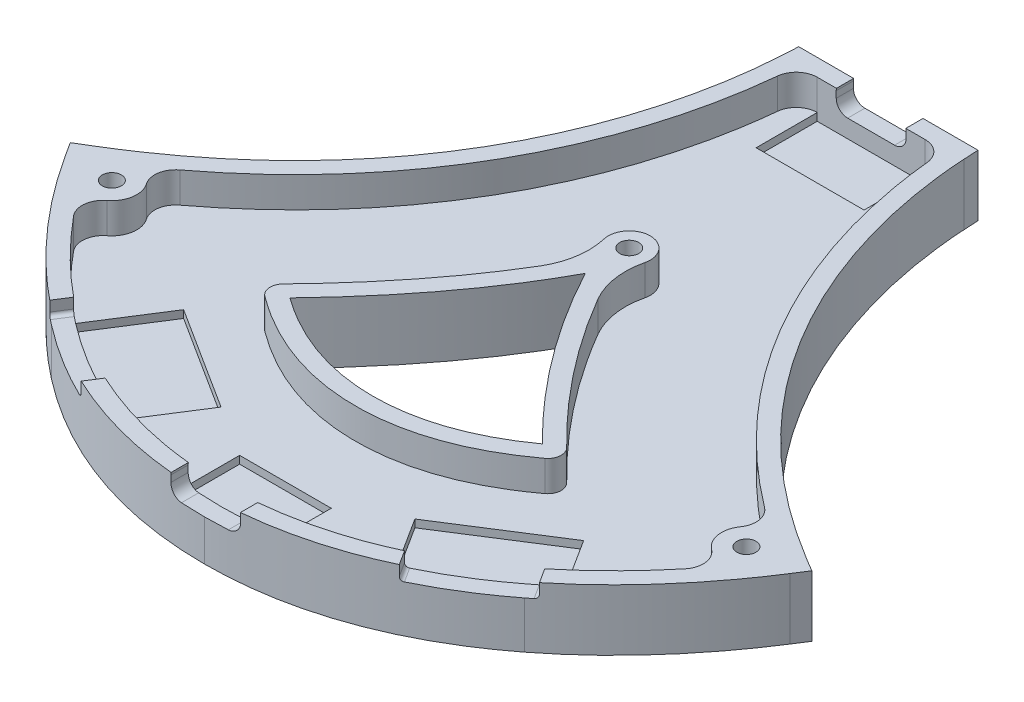
from build123d import *

# Parameters (mm, degrees)
BOSS_EXTRUDE4_DEPTH            = 3
SKETCH16_R                     = 3.25
CUT_EXTRUDE1_DEPTH             = 1.5
BOSS_EXTRUDE5_DEPTH            = 5
CBORE_FOR_M2_SHCS1_D           = 2.5
CBORE_FOR_M2_SHCS1_CBORE_D     = 4.4
CBORE_FOR_M2_SHCS1_CBORE_DEPTH = 2.75
CBORE_FOR_M2_SHCS2_D           = 2.5
CBORE_FOR_M2_SHCS2_CBORE_D     = 4.4
CBORE_FOR_M2_SHCS2_CBORE_DEPTH = 2.75
BOSS_EXTRUDE9_DEPTH            = 1
CUT_EXTRUDE11_DEPTH            = 5
CUT_EXTRUDE12_DEPTH            = 3
CUT_EXTRUDE13_DEPTH            = 4
CUT_EXTRUDE14_DEPTH            = 3


with BuildPart() as part:
    # Sketch10 → Boss-Extrude4 (new body)
    with BuildSketch(Plane(origin=(0, 0, 0), x_dir=(1, 0, 0), z_dir=(0, 1, 0))):
        with BuildLine():
            Line((48.547041226, -18.901094131), (46.77347558, -17.832646274))
            add(Edge.make_bspline(
                [(46.77347558, -17.832646274), (17.003528636, 0.102276889), (12.429063845, 27.023248475), (11.844136588, 37.765129514)],
                knots=[0, 0, 0, 0, 1, 1, 1, 1], degree=3))
            Line((11.844136588, 37.765129514), (11.740234172, 39.673072115))
            Line((11.740234172, 39.673072115), (-11.731466174, 39.673072115))
            Line((-11.731466174, 39.673072115), (-11.83536859, 37.765129514))
            add(Edge.make_bspline(
                [(-11.83536859, 37.765129514), (-12.420033135, 27.025612879), (-16.994235215, 0.109895523), (-46.766415207, -17.828442889)],
                knots=[4, 4, 4, 4, 5, 5, 5, 5], degree=3))
            Line((-46.766415207, -17.828442889), (-48.539586785, -18.896890746))
            Line((-48.539586785, -18.896890746), (-47.425952543, -20.641820833))
            add(Edge.make_bspline(
                [(-47.425952543, -20.641820833), (-44.221791175, -25.663026608), (-38.763958811, -32.914390694), (-30.959324209, -38.945196939)],
                knots=[7, 7, 7, 7, 8, 8, 8, 8], degree=3))
            add(Edge.make_bspline(
                [(-30.959324209, -38.945196939), (-21.548865284, -46.216789814), (-11.131170292, -49.903946359), (0.004383999, -49.903946359)],
                knots=[8, 8, 8, 8, 9, 9, 9, 9], degree=3))
            add(Edge.make_bspline(
                [(0.004383999, -49.903946359), (11.137573886, -49.903946359), (21.55395532, -46.217840661), (30.963888822, -38.948086766)],
                knots=[9, 9, 9, 9, 10, 10, 10, 10], degree=3))
            add(Edge.make_bspline(
                [(30.963888822, -38.948086766), (38.769705626, -32.917805944), (44.228326125, -25.666967281), (47.433012916, -20.646286929)],
                knots=[10, 10, 10, 10, 11, 11, 11, 11], degree=3))
            Line((47.433012916, -20.646286929), (48.547041226, -18.901094131))
        make_face()
        with BuildLine():
            add(Edge.make_bspline(
                [(16.526280274, -22.153643682), (11.287253789, -25.927609973), (5.739508399, -27.844583284), (0.004383999, -27.844583284), (-5.746437416, -27.844583284), (-11.308763297, -25.916920897), (-16.560367097, -22.122561622)],
                knots=[0, 0, 0, 0, 1, 1, 1, 2, 2, 2, 2], degree=3))
            add(Edge.make_bspline(
                [(-16.560367097, -22.122561622), (-9.578627154, -14.894792316), (-4.026727637, -7.475539132), (0, 0)],
                knots=[2, 2, 2, 2, 3, 3, 3, 3], degree=3))
            add(Edge.make_bspline(
                [(0, 0), (3.742194614, -7.061308703), (9.0389848, -14.76074375), (16.526280274, -22.153643682)],
                knots=[3, 3, 3, 3, 4, 4, 4, 4], degree=3))
        make_face(mode=Mode.SUBTRACT)
    extrude(amount=BOSS_EXTRUDE4_DEPTH)

    # Sketch16 → Cut-Extrude1 (cut)
    with BuildSketch(Plane.XZ):
        with Locations(Location((-41.547041226, 20.401094131, 0), (0, 0, 270))):
            Circle(SKETCH16_R)
        with Locations(Location((41.547041226, 20.401094131, 0), (0, 0, 270))):
            Circle(SKETCH16_R)
        with Locations(Location((0, -32.673072115, 0), (0, 0, 270))):
            Circle(SKETCH16_R)
        with Locations(Location((0, 42.903946359, 0), (0, 0, 270))):
            Circle(SKETCH16_R)
    extrude(amount=-CUT_EXTRUDE1_DEPTH, mode=Mode.SUBTRACT)

    # Sketch17 → Boss-Extrude5 (add)
    # profile 1 of 2: a face of its own
    with BuildSketch(Plane(origin=(0, 3, 0), x_dir=(1, 0, 0), z_dir=(0, 1, 0))):
        with BuildLine():
            Line((47.433012916, -20.646286929), (48.547041226, -18.901094131))
            Line((48.547041226, -18.901094131), (46.77347558, -17.832646274))
            add(Edge.make_bspline(
                [(46.77347558, -17.832646274), (17.003528636, 0.102276889), (12.429063845, 27.023248475), (11.844136588, 37.765129514)],
                knots=[0, 0, 0, 0, 1, 1, 1, 1], degree=3))
            Line((11.844136588, 37.765129514), (11.740234172, 39.673072115))
            Line((11.740234172, 39.673072115), (-11.731466174, 39.673072115))
            Line((-11.731466174, 39.673072115), (-11.83536859, 37.765129514))
            add(Edge.make_bspline(
                [(-11.83536859, 37.765129514), (-12.420033135, 27.025612879), (-16.994235215, 0.109895523), (-46.766415207, -17.828442889)],
                knots=[4, 4, 4, 4, 5, 5, 5, 5], degree=3))
            Line((-46.766415207, -17.828442889), (-48.539586785, -18.896890746))
            Line((-48.539586785, -18.896890746), (-47.425952543, -20.641820833))
            add(Edge.make_bspline(
                [(-47.425952543, -20.641820833), (-44.221791175, -25.663026608), (-38.763958811, -32.914390694), (-30.959324209, -38.945196939)],
                knots=[7, 7, 7, 7, 8, 8, 8, 8], degree=3))
            add(Edge.make_bspline(
                [(-30.959324209, -38.945196939), (-21.548865284, -46.216789814), (-11.131170292, -49.903946359), (0.004383999, -49.903946359)],
                knots=[8, 8, 8, 8, 9, 9, 9, 9], degree=3))
            add(Edge.make_bspline(
                [(0.004383999, -49.903946359), (11.137573886, -49.903946359), (21.55395532, -46.217840661), (30.963888822, -38.948086766)],
                knots=[9, 9, 9, 9, 10, 10, 10, 10], degree=3))
            add(Edge.make_bspline(
                [(30.963888822, -38.948086766), (38.769705626, -32.917805944), (44.228326125, -25.666967281), (47.433012916, -20.646286929)],
                knots=[10, 10, 10, 10, 11, 11, 11, 11], degree=3))
        make_face()
        with BuildLine():
            Line((7.068263687, 37.423072115), (-7.059496612, 37.423072115))
            ThreePointArc((-7.059496612, 37.423072115), (-8.905984327, 36.71095904), (-9.796175282, 34.943423474))
            add(Edge.make_bspline(
                [(-9.796175282, 34.943423474), (-10.039732368, 32.47793931), (-10.421381512, 30.041875059), (-11.434121187, 25.222888962), (-12.066446549, 22.840230191), (-13.205408829, 19.306821742), (-13.615505418, 18.14048746), (-14.492032045, 15.84181519), (-14.959028518, 14.707696156), (-16.445333502, 11.350522238), (-17.549431756, 9.172372061), (-19.984998159, 4.936486963), (-21.31627046, 2.87864832), (-23.486631791, -0.116248879), (-24.240945703, -1.101428661), (-25.792844121, -3.02222348), (-26.591464782, -3.959580749), (-30.694623315, -8.534522128), (-34.328172554, -11.837744424), (-38.280471055, -14.817033894)],
                knots=[0, 0, 0, 0, 0.125, 0.125, 0.25, 0.25, 0.3125, 0.3125, 0.375, 0.375, 0.5, 0.5, 0.625, 0.625, 0.6875, 0.6875, 0.75, 0.75, 1, 1, 1, 1], degree=3))
            ThreePointArc((-38.280471055, -14.817033894), (-39.341345642, -16.583061328), (-38.87779291, -18.59040451))
            ThreePointArc((-38.87779291, -18.59040451), (-38.328780037, -20.955513475), (-39.57199047, -23.041078565))
            ThreePointArc((-39.57199047, -23.041078565), (-40.638859687, -24.916061766), (-40.024485045, -26.983987965))
            add(Edge.make_bspline(
                [(-40.024485045, -26.983987965), (-38.469797239, -28.86056891), (-36.823428894, -30.659562666), (-33.341324403, -34.06968609), (-31.512203206, -35.67450945), (-29.583574251, -37.164800339)],
                knots=[0, 0, 0, 0, 0.5, 0.5, 1, 1, 1, 1], degree=3))
            add(Edge.make_bspline(
                [(-29.583574251, -37.164800339), (-27.462446118, -38.803825001), (-25.240902366, -40.291315562), (-20.565069837, -42.915068374), (-18.137786084, -44.035601692), (-13.092505846, -45.852667021), (-10.526062099, -46.530162707), (-5.319023979, -47.4304649), (-2.676532245, -47.653946359), (0.004383999, -47.653946359)],
                knots=[0, 0, 0, 0, 0.25, 0.25, 0.5, 0.5, 0.75, 0.75, 1, 1, 1, 1], degree=3))
            add(Edge.make_bspline(
                [(0.004383999, -47.653946359), (2.685429209, -47.653946359), (5.347189627, -47.430517033), (10.62983598, -46.510095696), (13.192640025, -45.823090359), (16.922419268, -44.47439355), (18.146840012, -43.971755386), (20.558934954, -42.862958017), (21.748760756, -42.255577496), (25.250267003, -40.290301886), (27.469181884, -38.804715085), (29.588341214, -37.167533824)],
                knots=[0, 0, 0, 0, 0.25, 0.25, 0.5, 0.5, 0.625, 0.625, 0.75, 0.75, 1, 1, 1, 1], degree=3))
            add(Edge.make_bspline(
                [(29.588341214, -37.167533824), (31.516845192, -35.677693306), (33.350363623, -34.069285997), (36.832552375, -30.65939756), (38.475605265, -28.864292177), (40.030337711, -26.988124476)],
                knots=[0, 0, 0, 0, 0.5, 0.5, 1, 1, 1, 1], degree=3))
            ThreePointArc((40.030337711, -26.988124476), (40.644965678, -24.920282954), (39.5783368, -23.045172574))
            ThreePointArc((39.5783368, -23.045172574), (38.335447125, -20.959802509), (38.884296078, -18.594996411))
            ThreePointArc((38.884296078, -18.594996411), (39.347726523, -16.587708365), (38.286886104, -14.821755172))
            add(Edge.make_bspline(
                [(38.286886104, -14.821755172), (34.332887388, -11.841239648), (30.685979543, -8.526627175), (26.557173498, -3.915732969), (25.757161766, -2.974552088), (24.213208924, -1.059967377), (23.468484471, -0.085673815), (21.315924071, 2.888121311), (19.989504384, 4.938414605), (17.554541532, 9.174923988), (16.44615102, 11.361235309), (14.950565713, 14.74488593), (14.479012929, 15.892963891), (13.60137214, 18.201035618), (13.194284372, 19.362992403), (12.066139526, 22.872106473), (11.437727037, 25.242389185), (10.429926535, 30.045114719), (10.048566345, 32.477065255), (9.804944934, 34.943397382)],
                knots=[0, 0, 0, 0, 0.25, 0.25, 0.3125, 0.3125, 0.375, 0.375, 0.5, 0.5, 0.625, 0.625, 0.6875, 0.6875, 0.75, 0.75, 0.875, 0.875, 1, 1, 1, 1], degree=3))
            ThreePointArc((9.804944934, 34.943397382), (8.914761116, 36.710950238), (7.068263687, 37.423072115))
        make_face(mode=Mode.SUBTRACT)
    # profile 2 of 2: a face of its own
    with BuildSketch(Plane(origin=(0, 3, 0), x_dir=(1, 0, 0), z_dir=(0, 1, 0))):
        with BuildLine():
            ThreePointArc((-18.579688368, -20.974510995), (-19.064277876, -22.343746169), (-18.348004118, -23.607306161))
            add(Edge.make_bspline(
                [(-18.348004118, -23.607306161), (-18.012692164, -23.850333745), (-17.677272802, -24.093155875), (-16.99950857, -24.565552777), (-16.657516563, -24.795802516), (-15.621935318, -25.468178516), (-14.918751273, -25.891951487), (-12.768237713, -27.084917916), (-11.279878536, -27.775628365), (-8.952153454, -28.629618242), (-8.156750344, -28.884541269), (-6.560416934, -29.320699228), (-5.757253558, -29.503034929), (-3.332726817, -29.942478869), (-1.696317866, -30.091959748), (0.789097247, -30.09584373), (1.623416737, -30.059869103), (3.268841467, -29.914767842), (4.084194809, -29.805797892), (6.508735237, -29.372389001), (8.096407676, -28.941475507), (10.436615111, -28.090708257), (11.205838328, -27.774096437), (12.707615729, -27.086345799), (13.442779643, -26.714186997), (14.884076987, -25.917653535), (15.590256675, -25.493362078), (16.629305369, -24.820554558), (16.97228153, -24.590217793), (17.65169929, -24.117790831), (17.987816018, -23.875116302), (18.323853111, -23.632298541)],
                knots=[0, 0, 0, 0, 0.03125, 0.03125, 0.0625, 0.0625, 0.125, 0.125, 0.25, 0.25, 0.3125, 0.3125, 0.375, 0.375, 0.5, 0.5, 0.5625, 0.5625, 0.625, 0.625, 0.75, 0.75, 0.8125, 0.8125, 0.875, 0.875, 0.9375, 0.9375, 0.96875, 0.96875, 1, 1, 1, 1], degree=3))
            ThreePointArc((18.323853111, -23.632298541), (19.043759767, -22.347888183), (18.528461955, -20.96859716))
            add(Edge.make_bspline(
                [(18.528461955, -20.96859716), (17.814540035, -20.263675959), (17.104490754, -19.555039431), (15.714770576, -18.108621986), (15.031825376, -17.373982367), (13.01917225, -15.135350803), (11.728485296, -13.59984981), (8.012778443, -8.862651272), (5.759492587, -5.55111656), (3.735219479, -2.084877509)],
                knots=[0, 0, 0, 0, 0.125, 0.125, 0.25, 0.25, 0.5, 0.5, 1, 1, 1, 1], degree=3))
            ThreePointArc((3.735219479, -2.084877509), (2.509051861, 1.40896281), (2.674021477, 5.108042726))
            ThreePointArc((2.674021477, 5.108042726), (0.005290296, 8.499994911), (-2.676471603, 5.118335723))
            ThreePointArc((-2.676471603, 5.118335723), (-2.531638697, 1.380192357), (-3.805102641, -2.137332623))
            add(Edge.make_bspline(
                [(-3.805102641, -2.137332623), (-5.863935841, -5.568909957), (-8.167106672, -8.846459266), (-11.892047369, -13.552940351), (-13.176826275, -15.083839106), (-15.161428704, -17.329426811), (-15.832577282, -18.069474155), (-17.19314015, -19.533454762), (-17.884941564, -20.255282097), (-18.579688368, -20.974510995)],
                knots=[0, 0, 0, 0, 0.5, 0.5, 0.75, 0.75, 0.875, 0.875, 1, 1, 1, 1], degree=3))
        make_face()
        with BuildLine():
            add(Edge.make_bspline(
                [(0, 0), (-4.026727637, -7.475539132), (-9.578627154, -14.894792316), (-16.560367097, -22.122561622)],
                knots=[2, 2, 2, 2, 3, 3, 3, 3], degree=3))
            add(Edge.make_bspline(
                [(-16.560367097, -22.122561622), (-11.308763297, -25.916920897), (-5.746437416, -27.844583284), (0.004383999, -27.844583284), (5.739508399, -27.844583284), (11.287253789, -25.927609973), (16.526280274, -22.153643682)],
                knots=[0, 0, 0, 0, 1, 1, 1, 2, 2, 2, 2], degree=3))
            add(Edge.make_bspline(
                [(16.526280274, -22.153643682), (9.0389848, -14.76074375), (3.742194614, -7.061308703), (0, 0)],
                knots=[3, 3, 3, 3, 4, 4, 4, 4], degree=3))
        make_face(mode=Mode.SUBTRACT)
    extrude(amount=BOSS_EXTRUDE5_DEPTH)

    # CBORE for M2 SHCS1 (through all)
    with Locations(Plane.XZ.offset(-1.5)):
        with Locations((-41.539952506, 20.45464867), (41.546629106, 20.458992883)):
            CounterBoreHole(CBORE_FOR_M2_SHCS1_D / 2, CBORE_FOR_M2_SHCS1_CBORE_D / 2, CBORE_FOR_M2_SHCS1_CBORE_DEPTH)

    # CBORE for M2 SHCS2 (through all)
    with Locations(Plane(origin=(0, 0, 0), x_dir=(-1, 0, 0), z_dir=(0, -1, 0))):
        with Locations((0, 5.75)):
            CounterBoreHole(CBORE_FOR_M2_SHCS2_D / 2, CBORE_FOR_M2_SHCS2_CBORE_D / 2, CBORE_FOR_M2_SHCS2_CBORE_DEPTH)


with BuildPart() as boss_extrude9_tool:
    # Sketch30 → Boss-Extrude9 (new body)
    with BuildSketch(Plane(origin=(0, 3, 0), x_dir=(1, 0, 0), z_dir=(0, 1, 0))):
        with BuildLine():
            Line((-26.182998455, -26.417150682), (-12.688735322, -35.013944416))
            Line((-12.688735322, -35.013944416), (-18.33038121, -43.869554597))
            add(Edge.make_bspline(
                [(-18.33038121, -43.869554597), (-17.437727318, -44.255135028), (-16.53274498, -44.61365968), (-13.092505846, -45.852667021), (-10.526062099, -46.530162707), (-7.282586038, -47.09096302), (-6.640274312, -47.187916879), (-5.995616001, -47.271222727)],
                knots=[0.409063623, 0.409063623, 0.409063623, 0.409063623, 0.5, 0.5, 0.75, 0.75, 0.811451154, 0.811451154, 0.811451154, 0.811451154], degree=3))
            Line((-5.995616001, -47.271222727), (-5.995616001, -39.271222727))
            Line((-5.995616001, -39.271222727), (6.004383999, -39.271222727))
            Line((6.004383999, -39.271222727), (6.004383999, -47.271188923))
            add(Edge.make_bspline(
                [(6.004383999, -47.271188923), (6.667024732, -47.185544546), (7.328406996, -47.085319831), (10.62983598, -46.510095696), (13.192640025, -45.823090359), (16.575533774, -44.599828147), (17.462115092, -44.248108835), (18.339078022, -43.86929295)],
                knots=[0.187521295, 0.187521295, 0.187521295, 0.187521295, 0.25, 0.25, 0.5, 0.5, 0.590123389, 0.590123389, 0.590123389, 0.590123389], degree=3))
            Line((18.339078022, -43.86929295), (12.697432134, -35.013682769))
            Line((12.697432134, -35.013682769), (26.191695267, -26.416889035))
            Line((26.191695267, -26.416889035), (31.86306101, -35.319150044))
            add(Edge.make_bspline(
                [(31.86306101, -35.319150044), (32.972714387, -34.371998842), (34.048663273, -33.385485068), (36.832552375, -30.65939756), (38.475605265, -28.864292177), (40.030337711, -26.988124476)],
                knots=[0.200534692, 0.200534692, 0.200534692, 0.200534692, 0.5, 0.5, 1, 1, 1, 1], degree=3))
            ThreePointArc((40.030337711, -26.988124476), (40.644965678, -24.920282954), (39.5783368, -23.045172574))
            ThreePointArc((39.5783368, -23.045172574), (38.335447125, -20.959802509), (38.884296079, -18.594996411))
            ThreePointArc((38.884296079, -18.594996411), (39.347726523, -16.587708365), (38.286886104, -14.821755172))
            add(Edge.make_bspline(
                [(38.286886104, -14.821755172), (34.332887388, -11.841239648), (30.685979543, -8.526627175), (26.557173498, -3.915732969), (25.757161766, -2.974552088), (24.213208924, -1.059967377), (23.468484471, -0.085673815), (21.315924071, 2.888121311), (19.989504384, 4.938414605), (17.554541532, 9.174923988), (16.44615102, 11.361235309), (14.950565713, 14.74488593), (14.479012929, 15.892963891), (13.60137214, 18.201035618), (13.194284372, 19.362992403), (12.066139526, 22.872106473), (11.437727037, 25.242389185), (10.429926535, 30.045114719), (10.048566345, 32.477065255), (9.804944934, 34.943397382)],
                knots=[0, 0, 0, 0, 0.25, 0.25, 0.3125, 0.3125, 0.375, 0.375, 0.5, 0.5, 0.625, 0.625, 0.6875, 0.6875, 0.75, 0.75, 0.875, 0.875, 1, 1, 1, 1], degree=3))
            ThreePointArc((9.804944934, 34.943397382), (8.914761116, 36.710950238), (7.068263687, 37.423072115))
            Line((7.068263687, 37.423072115), (7.068263687, 29.423072115))
            Line((7.068263687, 29.423072115), (-7.059496612, 29.423072115))
            Line((-7.059496612, 29.423072115), (-7.059496612, 37.423072115))
            ThreePointArc((-7.059496612, 37.423072115), (-8.905984327, 36.71095904), (-9.796175282, 34.943423474))
            add(Edge.make_bspline(
                [(-9.796175282, 34.943423474), (-10.039732368, 32.47793931), (-10.421381512, 30.041875059), (-11.434121187, 25.222888962), (-12.066446549, 22.840230191), (-13.205408829, 19.306821742), (-13.615505418, 18.14048746), (-14.492032045, 15.84181519), (-14.959028518, 14.707696156), (-16.445333502, 11.350522238), (-17.549431756, 9.172372061), (-19.984998159, 4.936486963), (-21.31627046, 2.87864832), (-23.486631791, -0.116248879), (-24.240945703, -1.101428661), (-25.792844121, -3.02222348), (-26.591464782, -3.959580749), (-30.694623315, -8.534522128), (-34.328172554, -11.837744424), (-38.280471055, -14.817033894)],
                knots=[0, 0, 0, 0, 0.125, 0.125, 0.25, 0.25, 0.3125, 0.3125, 0.375, 0.375, 0.5, 0.5, 0.625, 0.625, 0.6875, 0.6875, 0.75, 0.75, 1, 1, 1, 1], degree=3))
            ThreePointArc((-38.280471055, -14.817033894), (-39.341345642, -16.583061328), (-38.87779291, -18.59040451))
            ThreePointArc((-38.87779291, -18.59040451), (-38.328779373, -20.955513578), (-39.571990063, -23.0410791))
            ThreePointArc((-39.571990063, -23.0410791), (-40.638859019, -24.916061843), (-40.024483838, -26.983986965))
            add(Edge.make_bspline(
                [(-40.024483838, -26.983986965), (-38.469797239, -28.86056891), (-36.823428894, -30.659562666), (-34.038834954, -33.386594277), (-32.963654545, -34.372553613), (-31.854372362, -35.319424507)],
                knots=[0, 0, 0, 0, 0.5, 0.5, 0.799687071, 0.799687071, 0.799687071, 0.799687071], degree=3))
            Line((-31.854372362, -35.319424507), (-26.182998455, -26.417150682))
        make_face()
        with BuildLine():
            ThreePointArc((-18.579688368, -20.974510995), (-19.064277876, -22.343746169), (-18.348004118, -23.607306161))
            add(Edge.make_bspline(
                [(-18.348004118, -23.607306161), (-18.012692164, -23.850333745), (-17.677272802, -24.093155875), (-16.99950857, -24.565552777), (-16.657516563, -24.795802516), (-15.621935318, -25.468178516), (-14.918751273, -25.891951487), (-12.768237713, -27.084917916), (-11.279878536, -27.775628365), (-8.952153454, -28.629618242), (-8.156750344, -28.884541269), (-6.560416934, -29.320699228), (-5.757253558, -29.503034929), (-3.332726817, -29.942478869), (-1.696317866, -30.091959748), (0.789097247, -30.09584373), (1.623416737, -30.059869103), (3.268841467, -29.914767842), (4.084194809, -29.805797892), (6.508735237, -29.372389001), (8.096407676, -28.941475507), (10.436615111, -28.090708257), (11.205838328, -27.774096437), (12.707615729, -27.086345799), (13.442779643, -26.714186997), (14.884076987, -25.917653535), (15.590256675, -25.493362078), (16.629305369, -24.820554558), (16.97228153, -24.590217793), (17.65169929, -24.117790831), (17.987816018, -23.875116302), (18.323853111, -23.632298541)],
                knots=[0, 0, 0, 0, 0.03125, 0.03125, 0.0625, 0.0625, 0.125, 0.125, 0.25, 0.25, 0.3125, 0.3125, 0.375, 0.375, 0.5, 0.5, 0.5625, 0.5625, 0.625, 0.625, 0.75, 0.75, 0.8125, 0.8125, 0.875, 0.875, 0.9375, 0.9375, 0.96875, 0.96875, 1, 1, 1, 1], degree=3))
            ThreePointArc((18.323853111, -23.632298541), (19.043759767, -22.347888183), (18.528461955, -20.96859716))
            add(Edge.make_bspline(
                [(18.528461955, -20.96859716), (17.814540035, -20.263675959), (17.104490754, -19.555039431), (15.714770576, -18.108621986), (15.031825376, -17.373982367), (13.01917225, -15.135350803), (11.728485296, -13.59984981), (8.012778443, -8.862651272), (5.759492587, -5.55111656), (3.735219479, -2.084877509)],
                knots=[0, 0, 0, 0, 0.125, 0.125, 0.25, 0.25, 0.5, 0.5, 1, 1, 1, 1], degree=3))
            ThreePointArc((3.735219479, -2.084877509), (2.509051861, 1.40896281), (2.674021477, 5.108042726))
            ThreePointArc((2.674021477, 5.108042726), (0.005290296, 8.499994911), (-2.676471603, 5.118335723))
            ThreePointArc((-2.676471603, 5.118335723), (-2.531638697, 1.380192357), (-3.805102641, -2.137332623))
            add(Edge.make_bspline(
                [(-3.805102641, -2.137332623), (-5.863935841, -5.568909957), (-8.167106672, -8.846459266), (-11.892047369, -13.552940351), (-13.176826275, -15.083839106), (-15.161428704, -17.329426811), (-15.832577282, -18.069474155), (-17.19314015, -19.533454762), (-17.884941564, -20.255282097), (-18.579688368, -20.974510995)],
                knots=[0, 0, 0, 0, 0.5, 0.5, 0.75, 0.75, 0.875, 0.875, 1, 1, 1, 1], degree=3))
        make_face(mode=Mode.SUBTRACT)
    extrude(amount=BOSS_EXTRUDE9_DEPTH)


with BuildPart() as part_1:
    add(part.part)


with BuildPart() as part_2:
    # Boss-Extrude9: joined with boss_extrude9_tool
    add(part_1.part.fuse(boss_extrude9_tool.part, tol=0.00001))

    # Sketch40 → Cut-Extrude11 (cut)
    with BuildSketch(Plane(origin=(-26.623119691, 5.6, 41.997107213), x_dir=(0.8433721136204577, 0, 0.5373299526058097), z_dir=(-0.5373299526058097, 0, 0.8433721136204577))):
        with BuildLine():
            Line((-6.141888368, 0.55), (6.158111632, 0.55))
            ThreePointArc((6.158111632, 0.55), (6.511665022, 0.696446609), (6.658111632, 1.05))
            Line((6.658111632, 1.05), (6.658111632, 6.25))
            ThreePointArc((6.658111632, 6.25), (6.511665022, 6.603553391), (6.158111632, 6.75))
            Line((6.158111632, 6.75), (-6.141888368, 6.75))
            ThreePointArc((-6.141888368, 6.75), (-6.495441759, 6.603553391), (-6.641888368, 6.25))
            Line((-6.641888368, 6.25), (-6.641888368, 1.05))
            ThreePointArc((-6.641888368, 1.05), (-6.495441759, 0.696446609), (-6.141888368, 0.55))
        make_face()
    extrude(amount=-CUT_EXTRUDE11_DEPTH, mode=Mode.SUBTRACT)

    # Sketch41 → Cut-Extrude12 (cut)
    with BuildSketch(Plane(origin=(0.004383999, 5.6, 49.903946359), x_dir=(1, 0, 0), z_dir=(0, 0, 1))):
        with BuildLine():
            Line((-3.077374703, -0.244999296), (3.062625297, -0.244999296))
            ThreePointArc((3.062625297, -0.244999296), (4.123285469, 0.194340532), (4.562625297, 1.255000704))
            Line((4.562625297, 1.255000704), (4.562625297, 2.105000704))
            ThreePointArc((4.562625297, 2.105000704), (4.123285469, 3.165660875), (3.062625297, 3.605000704))
            Line((3.062625297, 3.605000704), (-3.077374703, 3.605000704))
            ThreePointArc((-3.077374703, 3.605000704), (-4.138034874, 3.165660875), (-4.577374703, 2.105000704))
            Line((-4.577374703, 2.105000704), (-4.577374703, 1.255000704))
            ThreePointArc((-4.577374703, 1.255000704), (-4.138034874, 0.194340532), (-3.077374703, -0.244999296))
        make_face()
    extrude(amount=-CUT_EXTRUDE12_DEPTH, mode=Mode.SUBTRACT)

    # Sketch42 → Cut-Extrude13 (cut)
    with BuildSketch(Plane(origin=(26.663714106, 6.54, 41.976434451), x_dir=(0.8430083936492554, 0, -0.5379004073589294), z_dir=(0.5379004073589294, 0, 0.8430083936492554))):
        with BuildLine():
            Line((-6.146440151, 5.81), (6.153559849, 5.81))
            ThreePointArc((6.153559849, 5.81), (6.50711324, 5.663553391), (6.653559849, 5.31))
            Line((6.653559849, 5.31), (6.653559849, 0.11))
            ThreePointArc((6.653559849, 0.11), (6.50711324, -0.24355339), (6.153559849, -0.39))
            Line((6.153559849, -0.39), (-6.146440151, -0.39))
            ThreePointArc((-6.146440151, -0.39), (-6.499993541, -0.24355339), (-6.646440151, 0.11))
            Line((-6.646440151, 0.11), (-6.646440151, 5.31))
            ThreePointArc((-6.646440151, 5.31), (-6.499993541, 5.663553391), (-6.146440151, 5.81))
        make_face()
    extrude(amount=-CUT_EXTRUDE13_DEPTH, mode=Mode.SUBTRACT)

    # Sketch43 → Cut-Extrude14 (cut)
    with BuildSketch(Plane(origin=(0, 0, -39.673072115), x_dir=(-1, 0, 0), z_dir=(0, 0, -1))):
        with BuildLine():
            Line((-3.067010312, 9.205000312), (3.072989688, 9.205000312))
            ThreePointArc((3.072989688, 9.205000312), (4.13364986, 8.765660484), (4.572989688, 7.705000312))
            Line((4.572989688, 7.705000312), (4.572989688, 6.855000312))
            ThreePointArc((4.572989688, 6.855000312), (4.13364986, 5.79434014), (3.072989688, 5.355000312))
            Line((3.072989688, 5.355000312), (-3.067010312, 5.355000312))
            ThreePointArc((-3.067010312, 5.355000312), (-4.127670484, 5.79434014), (-4.567010312, 6.855000312))
            Line((-4.567010312, 6.855000312), (-4.567010312, 7.705000312))
            ThreePointArc((-4.567010312, 7.705000312), (-4.127670484, 8.765660484), (-3.067010312, 9.205000312))
        make_face()
    extrude(amount=-CUT_EXTRUDE14_DEPTH, mode=Mode.SUBTRACT)


solid = part_2.part
